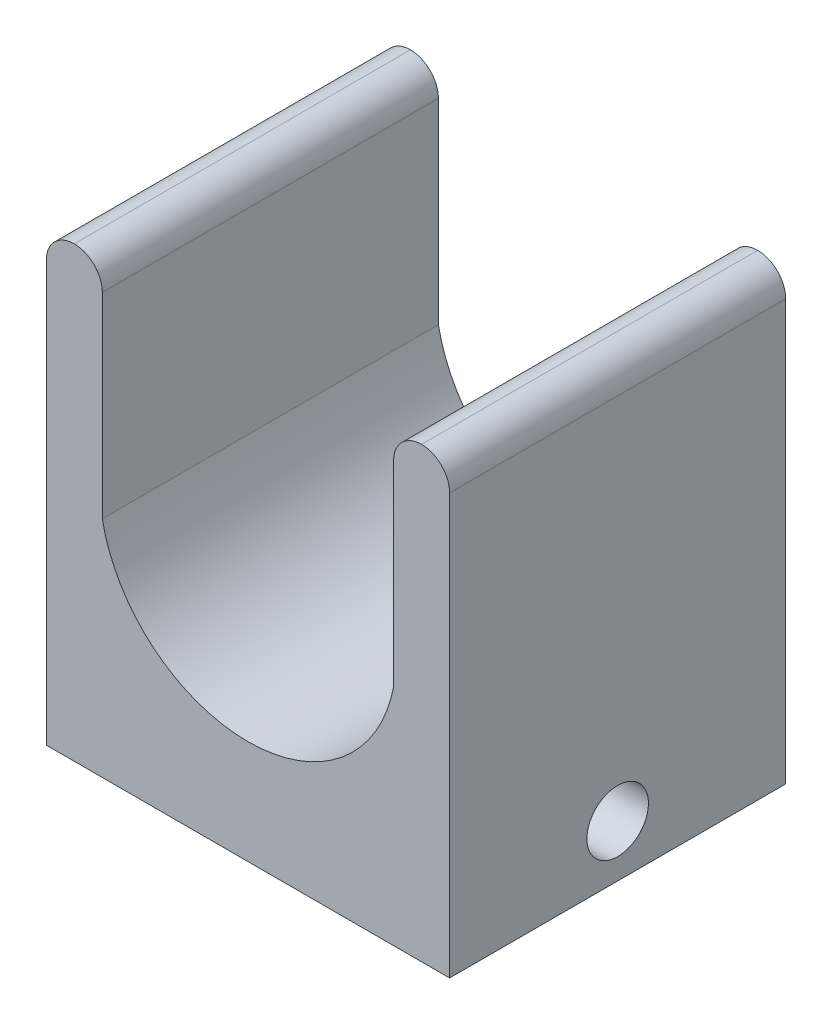
from build123d import *

# Parameters (mm, degrees)
BOSS_EXTRUDE1_DEPTH = 60
FILLET2_R           = 5
SKETCH5_R           = 5.5
CUT_EXTRUDE1_DEPTH  = 105.256230261


with BuildPart() as part:
    # Sketch2 → Boss-Extrude1 (new body)
    with BuildSketch(Plane.XY):
        with BuildLine():
            Line((-26, 45.665759035), (-26, 5.665759035))
            ThreePointArc((-26, 5.665759035), (0, -15.794380862), (26, 5.665759035))
            Line((26, 5.665759035), (26, 45.665759035))
            Line((26, 45.665759035), (36, 45.665759035))
            Line((36, 45.665759035), (36, 2.642754473))
            Line((36, 2.642754473), (36, -34.334240965))
            Line((36, -34.334240965), (-36, -34.334240965))
            Line((-36, -34.334240965), (-36, 5.665759035))
            Line((-36, 5.665759035), (-36, 45.665759035))
            Line((-36, 45.665759035), (-26, 45.665759035))
        make_face()
    extrude(amount=BOSS_EXTRUDE1_DEPTH)

    # Fillet2
    fillet2_edges = [part.edges().sort_by_distance(p)[0] for p in [
        (36, 45.665759035, 30),
        (26, 45.665759035, 30),
        (-26, 45.665759035, 30),
        (-36, 45.665759035, 30),
    ]]
    fillet(fillet2_edges, radius=FILLET2_R - 0.0001)  # a hair under: the kernel refuses the full size

    # Sketch5 → Cut-Extrude1 (cut, through all)
    with BuildSketch(Plane(origin=(36, 0, 0), x_dir=(0, 0, -1), z_dir=(1, 0, 0))):
        with Locations(Location((-30, -25.064310913, 0), (0, 0, 90))):
            Circle(SKETCH5_R)
    extrude(amount=-CUT_EXTRUDE1_DEPTH, mode=Mode.SUBTRACT)


solid = part.part
